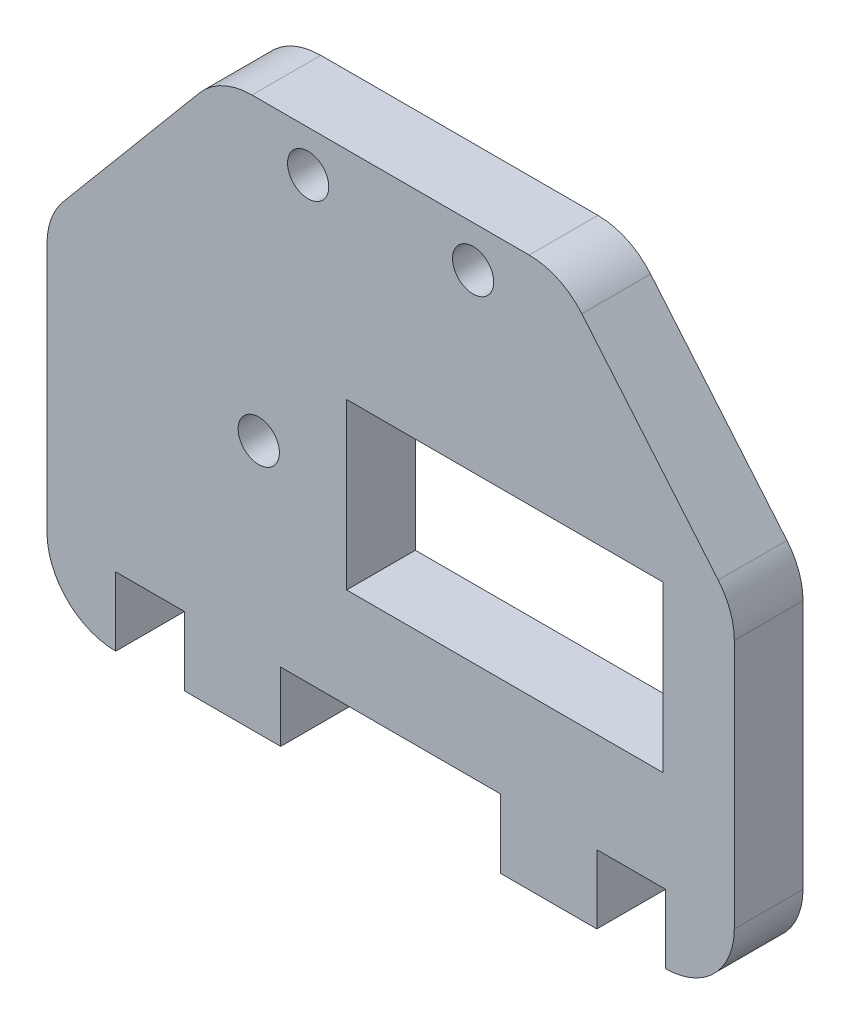
from build123d import *

# Parameters (mm, degrees)
SKETCH1_R           = 1.5
SKETCH1_W           = 23
SKETCH1_H           = 12
BOSS_EXTRUDE1_DEPTH = 5
FILLET1_R           = 5
FILLET2_R           = 5
FILLET3_R           = 5
FILLET4_R           = 5
FILLET5_R           = 5
FILLET6_R           = 5


with BuildPart() as part:
    # Sketch1 → Boss-Extrude1 (new body)
    with BuildSketch(Plane.XY):
        Polygon((28.231059773, 10.187376726), (15.644565305, 25.187376726), (-9.182445759, 25.187376726), (-21.768940227, 10.187376726), (-21.768940227, -14.812623274), (-16.768940227, -14.812623274), (-16.768940227, -9.812623274), (-11.768940227, -9.812623274), (-11.768940227, -14.812623274), (-4.768940227, -14.812623274), (-4.768940227, -9.812623274), (11.231059773, -9.812623274), (11.231059773, -14.812623274), (18.231059773, -14.812623274), (18.231059773, -9.812623274), (23.231059773, -9.812623274), (23.231059773, -14.812623274), (28.231059773, -14.812623274), align=None)
        with Locations((-2.768940227, 22.187376726)):
            Circle(SKETCH1_R, mode=Mode.SUBTRACT)
        with Locations((9.231059773, 22.187376726)):
            Circle(SKETCH1_R, mode=Mode.SUBTRACT)
        with Locations((-6.361893004, 3.645929715)):
            Circle(SKETCH1_R, mode=Mode.SUBTRACT)
        with Locations((11.531059773, 3.445929715)):
            Rectangle(SKETCH1_W, SKETCH1_H, mode=Mode.SUBTRACT)
    extrude(amount=BOSS_EXTRUDE1_DEPTH)

    # Fillet1
    fillet1_edges = [part.edges().sort_by_distance(p)[0] for p in [
        (15.644565305, 25.187376726, 2.5),
    ]]
    fillet(fillet1_edges, radius=FILLET1_R)

    # Fillet2
    fillet2_edges = [part.edges().sort_by_distance(p)[0] for p in [
        (28.231059773, 10.187376726, 2.5),
    ]]
    fillet(fillet2_edges, radius=FILLET2_R)

    # Fillet3
    fillet3_edges = [part.edges().sort_by_distance(p)[0] for p in [
        (28.231059773, -14.812623274, 2.5),
    ]]
    fillet(fillet3_edges, radius=FILLET3_R - 0.0001)  # a hair under: the kernel refuses the full size

    # Fillet4
    fillet4_edges = [part.edges().sort_by_distance(p)[0] for p in [
        (-9.182445759, 25.187376726, 2.5),
    ]]
    fillet(fillet4_edges, radius=FILLET4_R)

    # Fillet5
    fillet5_edges = [part.edges().sort_by_distance(p)[0] for p in [
        (-21.768940227, 10.187376726, 2.5),
    ]]
    fillet(fillet5_edges, radius=FILLET5_R)

    # Fillet6
    fillet6_edges = [part.edges().sort_by_distance(p)[0] for p in [
        (-21.768940227, -14.812623274, 2.5),
    ]]
    fillet(fillet6_edges, radius=FILLET6_R - 0.0001)  # a hair under: the kernel refuses the full size


solid = part.part
